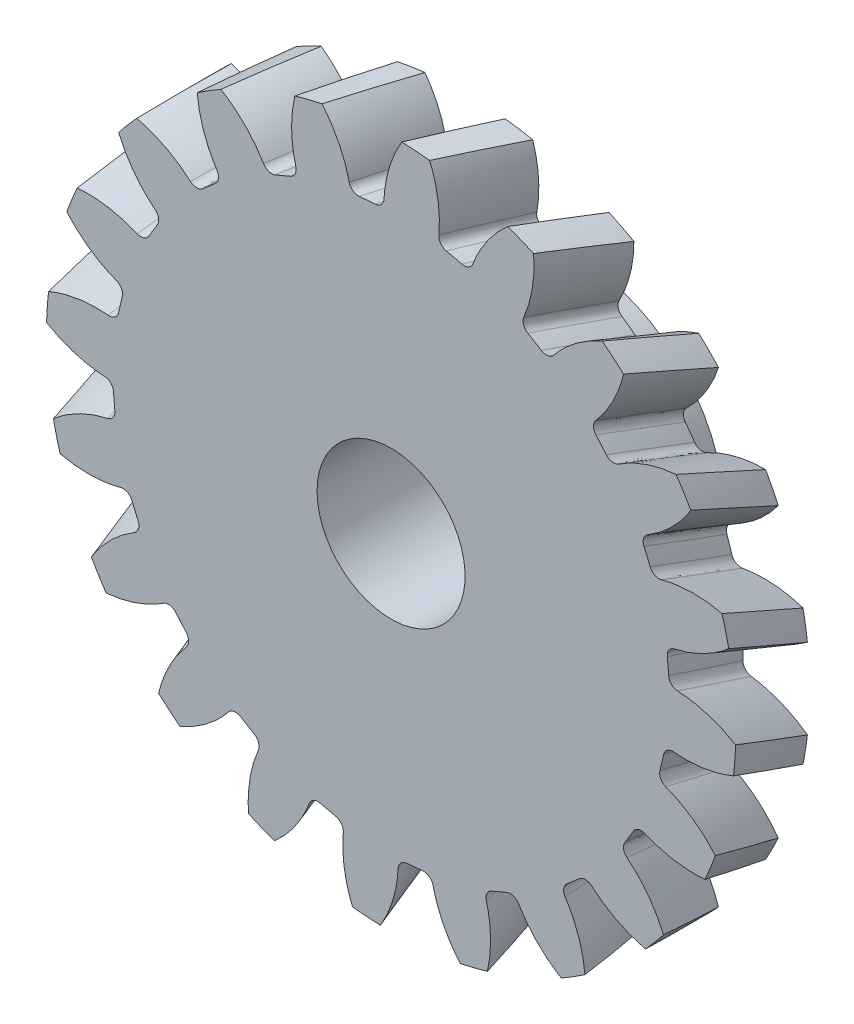
from build123d import *

# Parameters (mm, degrees)
GEARBODYSKETCH_R  = 29.570681109
GEARBODY_DEPTH    = 6.35
TOOTHCUTRH_PITCH  = 466.628208574
CIRPATTERN2_COUNT = 20
HD1SKETCH_R       = 12.7
HUB1_DEPTH        = 9.525
BORESKETCH_R      = 6.35
BORE_DEPTH        = 12700


with BuildPart() as part:
    # gearBodySketch → gearBody (new body)
    with BuildSketch(Plane.XY):
        Circle(GEARBODYSKETCH_R)
    extrude(amount=GEARBODY_DEPTH)

    # toothCutRH: arcs per turn and ends read off the stored shape
    # toothCutRH: the profile of toothSketchRH screwed along a right-hand helix through 1 turns, 26 arcs to a turn; built about Z, then put on its axis
    toothcutrh_z = Axis((0, 0, 0), (0, 0, 1))
    toothcutrh_corners = [(23.845966227, -0.680746576, 0), (23.845966227, 0.680746576, 0), (24.539840872, 1.499311516, 0), (29.393422478, 3.457561575, 0), (29.393422478, -3.457561575, 0), (24.539840872, -1.499311516, 0)]
    with BuildLine(mode=Mode.PRIVATE) as toothcutrh_profile:
        ThreePointArc((23.845966227, -0.680746576, 0), (23.855681109, 0, 0), (23.845966227, 0.680746576, 0))
        ThreePointArc((23.845966227, 0.680746576, 0), (24.036113344, 1.222935726, 0), (24.539840872, 1.499311516, 0))
        ThreePointArc((24.539840872, 1.499311516, 0), (27.088428423, 2.176559646, 0), (29.393422478, 3.457561575, 0))
        ThreePointArc((29.393422478, 3.457561575, 0), (29.596081109, 0, 0), (29.393422478, -3.457561575, 0))
        ThreePointArc((29.393422478, -3.457561575, 0), (27.088428423, -2.176559646, 0), (24.539840872, -1.499311516, 0))
        ThreePointArc((24.539840872, -1.499311516, 0), (24.036113344, -1.222935726, 0), (23.845966227, -0.680746576, 0))
    toothcutrh_cap = Face(toothcutrh_profile.wire())
    toothcutrh_arcs = [((23.845966227, -0.680746576, 0), (23.86539995, 0, 0), (23.845966227, 0.680746576, 0), (1, 0.9995927644032119, 1)), ((23.845966227, 0.680746576, 0), (23.825388656, 1.40156116, 0), (24.539840872, 1.499311516, 0), (1, 0.744052380143955, 1)), ((24.539840872, 1.499311516, 0), (27.214053714, 1.86519359, 0), (29.393422478, 3.457561575, 0), (1, 0.9695241110555992, 1)), ((29.393422478, 3.457561575, 0), (29.80013701, 0, 0), (29.393422478, -3.457561575, 0), (1, 0.9931525180525038, 1)), ((29.393422478, -3.457561575, 0), (27.214053714, -1.86519359, 0), (24.539840872, -1.499311516, 0), (1, 0.9695241110555994, 1)), ((24.539840872, -1.499311516, 0), (23.825388656, -1.40156116, 0), (23.845966227, -0.680746576, 0), (1, 0.744052380143955, 1))]  # start, shoulder, end, weights
    toothcutrh_turn_angles = [0, 6.923076923, 13.846153846, 20.769230769, 27.692307692, 34.615384615, 41.538461538, 48.461538462, 55.384615385, 62.307692308, 69.230769231, 76.153846154, 83.076923077, 90, 96.923076923, 103.846153846, 110.769230769, 117.692307692, 124.615384615, 131.538461538, 138.461538462, 145.384615385, 152.307692308, 159.230769231, 166.153846154, 173.076923077, 180, 186.923076923, 193.846153846, 200.769230769, 207.692307692, 214.615384615, 221.538461538, 228.461538462, 235.384615385, 242.307692308, 249.230769231, 256.153846154, 263.076923077, 270, 276.923076923, 283.846153846, 290.769230769, 297.692307692, 304.615384615, 311.538461538, 318.461538462, 325.384615385, 332.307692308, 339.230769231, 346.153846154, 353.076923077, 360]
    toothcutrh_turn_weights = [1, 0.992708874098054, 1, 0.992708874098054, 1, 0.992708874098054, 1, 0.992708874098054, 1, 0.992708874098054, 1, 0.992708874098054, 1, 0.992708874098054, 1, 0.992708874098054, 1, 0.992708874098054, 1, 0.992708874098054, 1, 0.992708874098054, 1, 0.992708874098054, 1, 0.992708874098054, 1, 0.992708874098054, 1, 0.992708874098054, 1, 0.992708874098054, 1, 0.992708874098054, 1, 0.992708874098054, 1, 0.992708874098054, 1, 0.9927088740980541, 1, 0.992708874098054, 1, 0.992708874098054, 1, 0.9927088740980541, 1, 0.992708874098054, 1, 0.992708874098054, 1, 0.9927088740980541, 1]
    toothcutrh_turn_sides = [Face.make_bezier_surface([[Vector(p[j][0], p[j][1], 0).rotate(toothcutrh_z, toothcutrh_turn_angles[2 * i + k]) / toothcutrh_turn_weights[2 * i + k] + Vector(0, 0, p[j][2] + TOOTHCUTRH_PITCH * toothcutrh_turn_angles[2 * i + k] / 360) for k in range(3)] for j in range(3)], [[p[3][j] * toothcutrh_turn_weights[2 * i + k] for k in range(3)] for j in range(3)]) for p in toothcutrh_arcs for i in range(26)]
    toothcutrh = Plane(origin=(0, 0, 0), x_dir=(0, 1, 0), z_dir=(0, 0, 1)) * Solid(Shell([*toothcutrh_turn_sides, toothcutrh_cap, toothcutrh_cap.rotate(toothcutrh_z, 360).moved(Location((0, 0, TOOTHCUTRH_PITCH * 360 / 360)))]))
    add(toothcutrh, mode=Mode.SUBTRACT)

    # CirPattern2: toothCutRH ×20 about axis
    cirpattern2_axis = Axis((0, 0, 6.35), (0, 0, -1))
    for i in range(1, CIRPATTERN2_COUNT):
        add(toothcutrh.rotate(cirpattern2_axis, i * 360 / CIRPATTERN2_COUNT), mode=Mode.SUBTRACT)

    # hd1Sketch → hub1 (add)
    with BuildSketch(Plane(origin=(0, 0, 0), x_dir=(-1, 0, 0), z_dir=(0, 0, -1))):
        with Locations(Location((0, 0, 0), (0, 0, 180))):
            Circle(HD1SKETCH_R)
    extrude(amount=HUB1_DEPTH)

    # boreSketch → bore (cut, symmetric)
    with BuildSketch(Plane(origin=(0, 0, 0), x_dir=(-1, 0, 0), z_dir=(0, 0, -1))):
        Circle(BORESKETCH_R)
    extrude(amount=BORE_DEPTH, both=True, mode=Mode.SUBTRACT)


solid = part.part
